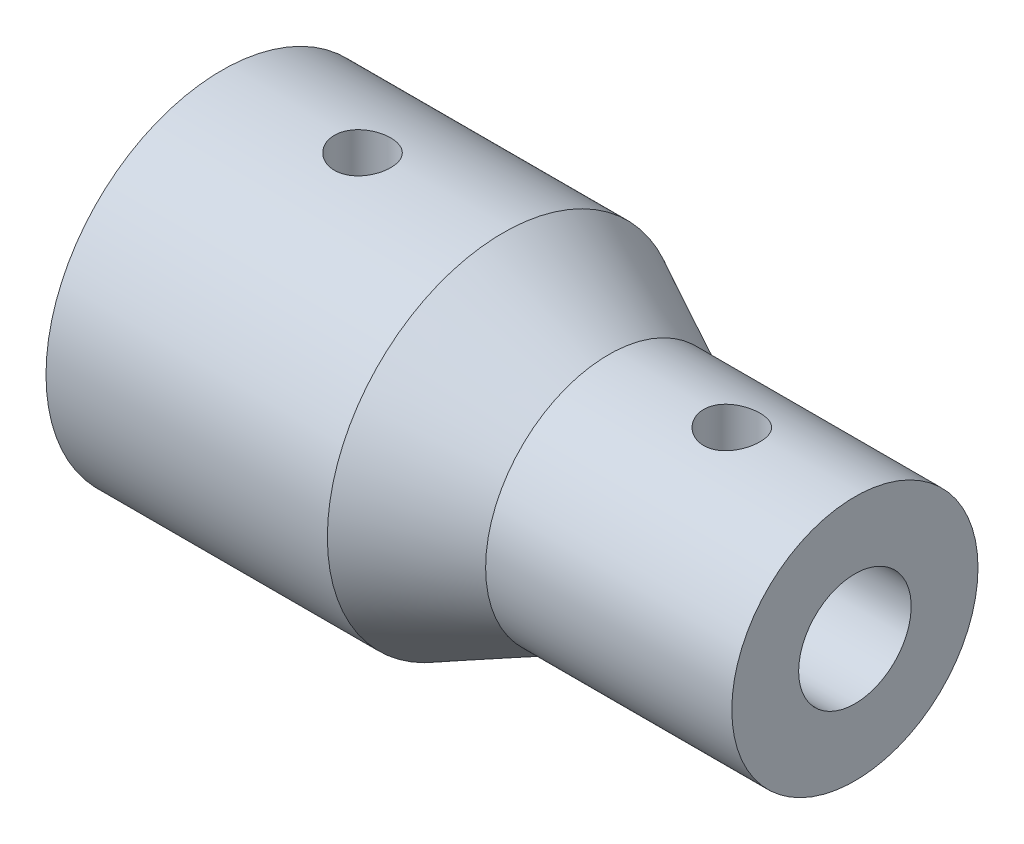
from build123d import *

# Parameters (mm, degrees)
SKETCH2_R          = 1.016
CUT_EXTRUDE1_DEPTH = 16.554259867
CIRPATTERN1_COUNT  = 2
CIRPATTERN1_ANGLE  = 90


with BuildPart() as part:
    # Sketch1 → Revolve1 (revolve)
    with BuildSketch(Plane(origin=(0, 0, 0), x_dir=(1, 0, 0), z_dir=(0, 1, 0))):
        Polygon((-10.16, 3.3655), (0, 3.3655), (2.54, 2.032), (12.7, 2.032), (12.7, 4.445), (3.81, 4.445), (0, 6.35), (-10.16, 6.35), align=None)
    revolve(axis=Axis((0, 0, 0), (1, 0, 0)))

    # Sketch2 → Cut-Extrude1 (cut, through all)
    with BuildSketch(Plane(origin=(0, 0, 0), x_dir=(1, 0, 0), z_dir=(0, 1, 0))):
        with Locations((-5.08, 0)):
            Circle(SKETCH2_R)
        with Locations((8.255, 0)):
            Circle(SKETCH2_R)
    cut_extrude1 = extrude(amount=CUT_EXTRUDE1_DEPTH, mode=Mode.SUBTRACT)

    # CirPattern1: Cut-Extrude1 ×2 about axis
    cirpattern1_axis = Axis((-10.16, 0, 0), (-1, 0, 0))
    for i in range(1, CIRPATTERN1_COUNT):
        add(cut_extrude1.rotate(cirpattern1_axis, i * CIRPATTERN1_ANGLE / (CIRPATTERN1_COUNT - 1)), mode=Mode.SUBTRACT)


solid = part.part
